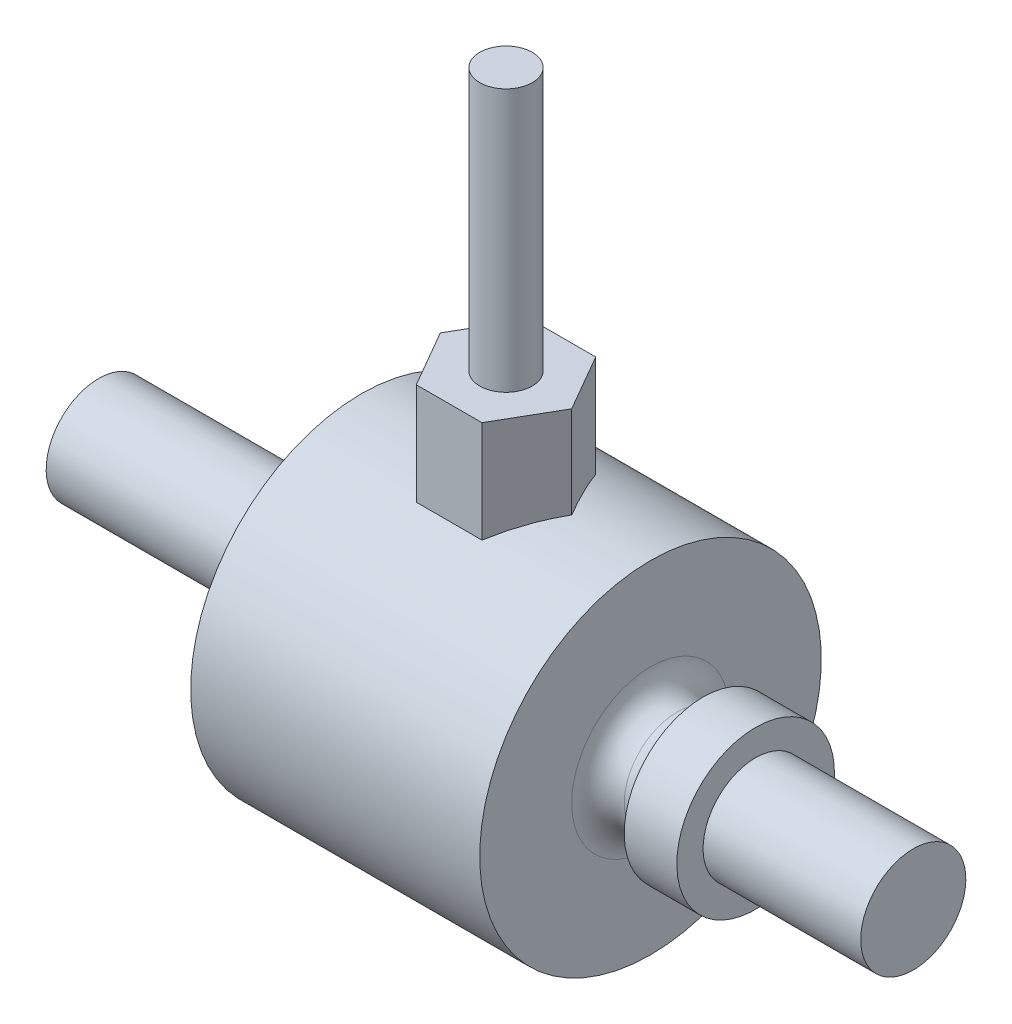
from build123d import *

# Parameters (mm, degrees)
FILLET1_R           = 1
BOSS_EXTRUDE1_DEPTH = 10
SKETCH4_R           = 1
BOSS_EXTRUDE2_DEPTH = 10


with BuildPart() as part:
    # Sketch2 → Revolve1 (revolve)
    with BuildSketch(Plane.XY):
        Polygon((0, 0), (0, 2), (8, 2), (8, 3), (10, 3), (10, 6.5), (21, 6.5), (21, 2), (23, 2), (23, 3), (25, 3), (25, 2), (31, 2), (31, 0), align=None)
    revolve(axis=Axis((31, 0, 0), (-1, 0, 0)))

    # Fillet1
    fillet1_edges = [part.edges().sort_by_distance(p)[0] for p in [
        (23, -2, 0),
        (21, -2, 0),
    ]]
    fillet(fillet1_edges, radius=FILLET1_R - 0.0001)  # a hair under: the kernel refuses the full size

    # Sketch3 → Boss-Extrude1 (add)
    with BuildSketch(Plane(origin=(0, 0, 0), x_dir=(1, 0, 0), z_dir=(0, 1, 0))):
        Polygon((16.75, 2.165063509), (14.25, 2.165063509), (13, 0), (14.25, -2.165063509), (16.75, -2.165063509), (18, 0), align=None)
    extrude(amount=BOSS_EXTRUDE1_DEPTH)

    # Sketch4 → Boss-Extrude2 (add)
    with BuildSketch(Plane(origin=(0, 10, 0), x_dir=(1, 0, 0), z_dir=(0, 1, 0))):
        with Locations(Location((15.5, 0, 0), (0, 0, 270))):
            Circle(SKETCH4_R)
    extrude(amount=BOSS_EXTRUDE2_DEPTH)


solid = part.part
